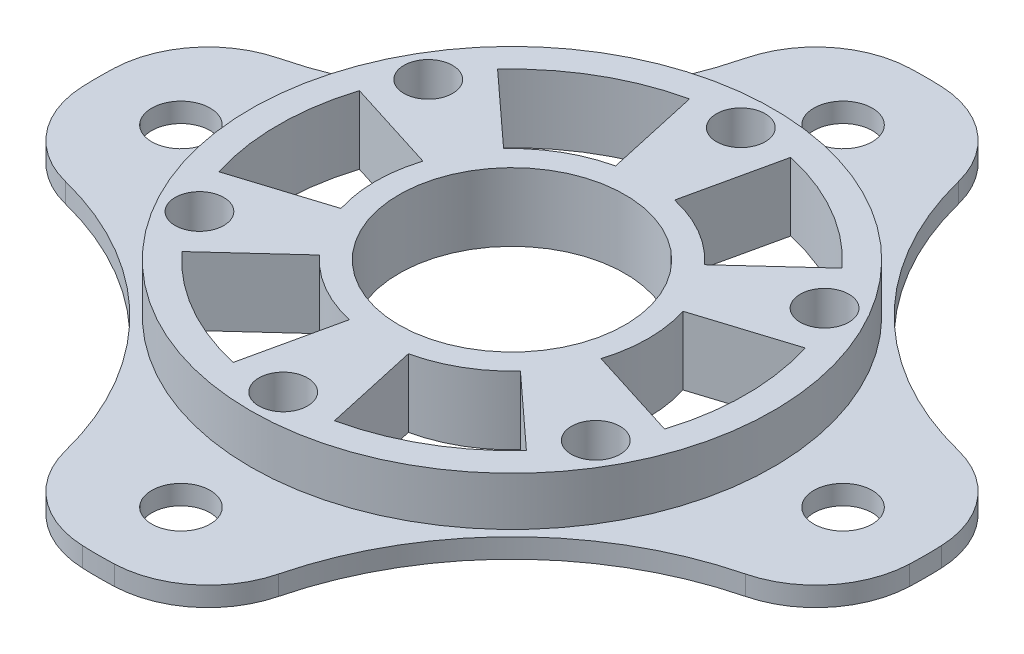
from build123d import *

# Parameters (mm, degrees)
SKETCH1_R           = 26.85
BOSS_EXTRUDE1_DEPTH = 5
SKETCH2_R           = 42.5
BOSS_EXTRUDE2_DEPTH = 2
SKETCH3_R           = 3
CUT_EXTRUDE1_DEPTH  = 2
SKETCH4_R           = 11.6
SKETCH4_R_2         = 2.5
CUT_EXTRUDE2_DEPTH  = 61.510329697
CUT_EXTRUDE3_DEPTH  = 61.510329697
FILLET1_R           = 10


with BuildPart() as part:
    # Sketch1 → Boss-Extrude1 (new body)
    with BuildSketch(Plane(origin=(0, 0, 0), x_dir=(1, 0, 0), z_dir=(0, 1, 0))):
        Circle(SKETCH1_R)
    extrude(amount=-BOSS_EXTRUDE1_DEPTH)

    # Sketch2 → Boss-Extrude2 (add)
    with BuildSketch(Plane.XZ.offset(5)):
        Circle(SKETCH2_R)
    extrude(amount=BOSS_EXTRUDE2_DEPTH)

    # Sketch3 → Cut-Extrude1 (cut)
    with BuildSketch(Plane(origin=(0, -5, 0), x_dir=(1, 0, 0), z_dir=(0, 1, 0))):
        with Locations((0, 34)):
            Circle(SKETCH3_R)
        with Locations((34, 0)):
            Circle(SKETCH3_R)
        with Locations((0, -34)):
            Circle(SKETCH3_R)
        with Locations((-34, 0)):
            Circle(SKETCH3_R)
        with BuildLine():
            ThreePointArc((-41.306779105, 10), (-19.624107624, 19.624107624), (-10, 41.306779105))
            ThreePointArc((-10, 41.306779105), (-30.0520382, 30.0520382), (-41.306779105, 10))
        make_face()
        with BuildLine():
            ThreePointArc((41.306779105, 10), (30.0520382, 30.0520382), (10, 41.306779105))
            ThreePointArc((10, 41.306779105), (19.624107624, 19.624107624), (41.306779105, 10))
        make_face()
        with BuildLine():
            ThreePointArc((-10, -41.306779105), (-19.624107624, -19.624107624), (-41.306779105, -10))
            ThreePointArc((-41.306779105, -10), (-30.0520382, -30.0520382), (-10, -41.306779105))
        make_face()
        with BuildLine():
            ThreePointArc((41.306779105, -10), (19.624107624, -19.624107624), (10, -41.306779105))
            ThreePointArc((10, -41.306779105), (30.0520382, -30.0520382), (41.306779105, -10))
        make_face()
    extrude(amount=-CUT_EXTRUDE1_DEPTH, mode=Mode.SUBTRACT)

    # Sketch4 → Cut-Extrude2 (cut, through all)
    with BuildSketch(Plane(origin=(0, 0, 0), x_dir=(1, 0, 0), z_dir=(0, 1, 0))):
        Circle(SKETCH4_R)
        with Locations((0, 23.5)):
            Circle(SKETCH4_R_2)
        with Locations((20.351596989, 11.75)):
            Circle(SKETCH4_R_2)
        with Locations((20.351596989, -11.75)):
            Circle(SKETCH4_R_2)
        with Locations((0, -23.5)):
            Circle(SKETCH4_R_2)
        with Locations((-20.351596989, -11.75)):
            Circle(SKETCH4_R_2)
        with Locations((-20.351596989, 11.75)):
            Circle(SKETCH4_R_2)
    extrude(amount=-CUT_EXTRUDE2_DEPTH, mode=Mode.SUBTRACT)

    # Sketch5 → Cut-Extrude3 (cut, through all)
    with BuildSketch(Plane(origin=(0, 0, 0), x_dir=(1, 0, 0), z_dir=(0, 1, 0))):
        with BuildLine():
            Line((-17.694656083, 16.214164983), (-10.321882715, 9.458262907))
            ThreePointArc((-10.321882715, 9.458262907), (-7, 12.124355653), (-3.030154595, 13.6681441))
            Line((-3.030154595, 13.6681441), (-5.194550735, 23.431104171))
            ThreePointArc((-5.194550735, 23.431104171), (-12, 20.784609691), (-17.694656083, 16.214164983))
        make_face()
        with BuildLine():
            Line((17.694656083, 16.214164983), (10.321882715, 9.458262907))
            ThreePointArc((10.321882715, 9.458262907), (7, 12.124355653), (3.030154595, 13.6681441))
            Line((3.030154595, 13.6681441), (5.194550735, 23.431104171))
            ThreePointArc((5.194550735, 23.431104171), (12, 20.784609691), (17.694656083, 16.214164983))
        make_face()
        with BuildLine():
            Line((22.889206818, -7.216939188), (13.35203731, -4.209881193))
            ThreePointArc((13.35203731, -4.209881193), (14, 0), (13.35203731, 4.209881193))
            Line((13.35203731, 4.209881193), (22.889206818, 7.216939188))
            ThreePointArc((22.889206818, 7.216939188), (24, 0), (22.889206818, -7.216939188))
        make_face()
        with BuildLine():
            Line((5.194550735, -23.431104171), (3.030154595, -13.6681441))
            ThreePointArc((3.030154595, -13.6681441), (7, -12.124355653), (10.321882715, -9.458262907))
            Line((10.321882715, -9.458262907), (17.694656083, -16.214164983))
            ThreePointArc((17.694656083, -16.214164983), (12, -20.784609691), (5.194550735, -23.431104171))
        make_face()
        with BuildLine():
            Line((-17.694656083, -16.214164983), (-10.321882715, -9.458262907))
            ThreePointArc((-10.321882715, -9.458262907), (-7, -12.124355653), (-3.030154595, -13.6681441))
            Line((-3.030154595, -13.6681441), (-5.194550735, -23.431104171))
            ThreePointArc((-5.194550735, -23.431104171), (-12, -20.784609691), (-17.694656083, -16.214164983))
        make_face()
        with BuildLine():
            Line((-22.889206818, 7.216939188), (-13.35203731, 4.209881193))
            ThreePointArc((-13.35203731, 4.209881193), (-14, 0), (-13.35203731, -4.209881193))
            Line((-13.35203731, -4.209881193), (-22.889206818, -7.216939188))
            ThreePointArc((-22.889206818, -7.216939188), (-24, 0), (-22.889206818, 7.216939188))
        make_face()
    extrude(amount=-CUT_EXTRUDE3_DEPTH, mode=Mode.SUBTRACT)

    # Fillet1
    fillet1_edges = [part.edges().sort_by_distance(p)[0] for p in [
        (10, -6, -41.306779105),
        (-10, -6, -41.306779105),
        (-41.306779105, -6, -10),
        (-41.306779105, -6, 10),
        (10, -6, 41.306779105),
        (-10, -6, 41.306779105),
        (41.306779105, -6, 10),
        (41.306779105, -6, -10),
    ]]
    fillet(fillet1_edges, radius=FILLET1_R)


solid = part.part
